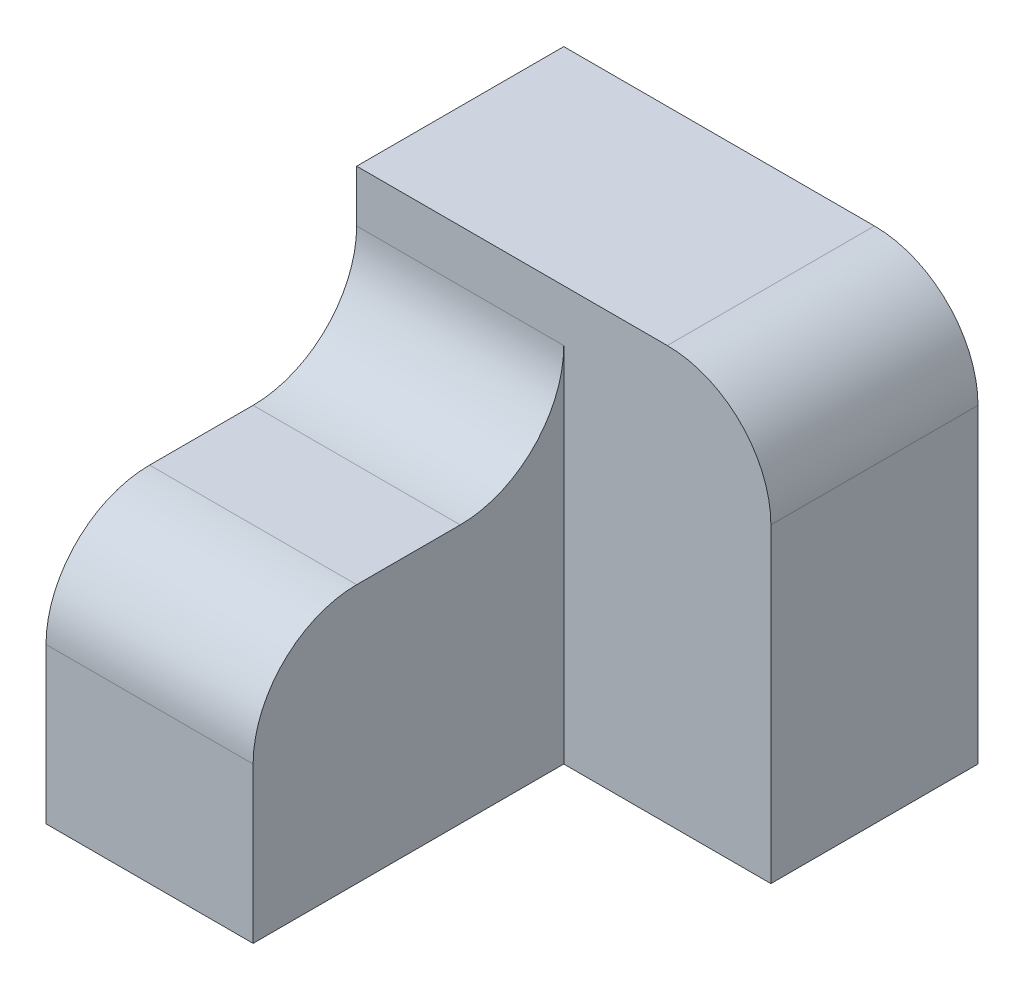
from build123d import *

# Parameters (mm, degrees)
SKETCH1_W           = 20
SKETCH1_H           = 25
BOSS_EXTRUDE1_DEPTH = 30
SKETCH2_W           = 40
SKETCH2_H           = 40
BOSS_EXTRUDE2_DEPTH = 20
FILLET1_R           = 10


with BuildPart() as part:
    # Sketch1 → Boss-Extrude1 (new body)
    with BuildSketch(Plane.XY):
        with Locations((-20, -12.5)):
            Rectangle(SKETCH1_W, SKETCH1_H)
    extrude(amount=BOSS_EXTRUDE1_DEPTH)

    # Sketch2 → Boss-Extrude2 (add)
    with BuildSketch(Plane.XY):
        with Locations((-10, -5)):
            Rectangle(SKETCH2_W, SKETCH2_H)
    extrude(amount=-BOSS_EXTRUDE2_DEPTH)

    # Fillet1
    fillet1_edges = [part.edges().sort_by_distance(p)[0] for p in [
        (-20, 0, 0),
        (10, 15, -10),
        (-20, 0, 30),
    ]]
    fillet(fillet1_edges, radius=FILLET1_R)


solid = part.part
